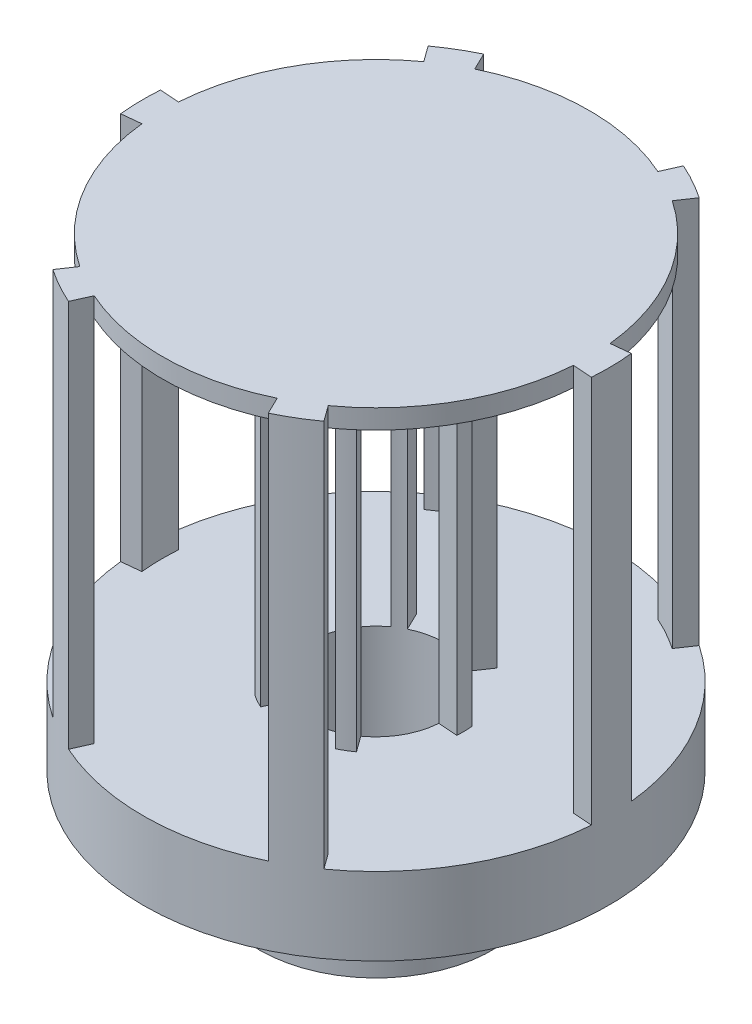
from build123d import *

# Parameters (mm, degrees)
SKETCH1_R           = 6
BOSS_EXTRUDE1_DEPTH = 6
SKETCH2_R           = 12
BOSS_EXTRUDE2_DEPTH = 3
BOSS_EXTRUDE3_START = 1
SKETCH5_R           = 12
SKETCH5_R_2         = 11
BOSS_EXTRUDE3_DEPTH = 1
SKETCH6_R           = 12
SKETCH6_R_2         = 11
BOSS_EXTRUDE4_DEPTH = 20
CUT_EXTRUDE1_START  = -20
CUT_EXTRUDE1_DEPTH  = 20
CIRPATTERN1_COUNT   = 6
SKETCH8_R           = 3.5
CUT_EXTRUDE2_DEPTH  = 9
BOSS_EXTRUDE5_DEPTH = 20
CIRPATTERN2_COUNT   = 6
BOSS_EXTRUDE6_START = -1
SKETCH12_R          = 11
BOSS_EXTRUDE6_DEPTH = 1


with BuildPart() as part:
    # Sketch1 → Boss-Extrude1 (new body)
    with BuildSketch(Plane(origin=(0, 0, 0), x_dir=(1, 0, 0), z_dir=(0, 1, 0))):
        Circle(SKETCH1_R)
    extrude(amount=BOSS_EXTRUDE1_DEPTH)

    # Sketch2 → Boss-Extrude2 (add)
    with BuildSketch(Plane(origin=(0, 6, 0), x_dir=(1, 0, 0), z_dir=(0, 1, 0))):
        Circle(SKETCH2_R)
    extrude(amount=BOSS_EXTRUDE2_DEPTH)

    # Sketch5 → Boss-Extrude3 (add)
    with BuildSketch(Plane.XZ.offset(-6).offset(BOSS_EXTRUDE3_START)):
        Circle(SKETCH5_R)
        Circle(SKETCH5_R_2, mode=Mode.SUBTRACT)
    extrude(amount=-BOSS_EXTRUDE3_DEPTH)

    # Sketch6 → Boss-Extrude4 (add)
    with BuildSketch(Plane(origin=(0, 9, 0), x_dir=(1, 0, 0), z_dir=(0, 1, 0))):
        Circle(SKETCH6_R)
        Circle(SKETCH6_R_2, mode=Mode.SUBTRACT)
    extrude(amount=BOSS_EXTRUDE4_DEPTH)

    # Sketch7 → Cut-Extrude1 (cut)
    with BuildSketch(Plane(origin=(0, 29, 0), x_dir=(1, 0, 0), z_dir=(0, 1, 0)).offset(CUT_EXTRUDE1_START)):
        with BuildLine():
            Line((-5.240054276, 10.795454191), (-4.803383087, 9.895833008))
            ThreePointArc((-4.803383087, 9.895833008), (-0.171183751, 10.998667925), (4.493092753, 10.040523767))
            Line((4.493092753, 10.040523767), (4.901555731, 10.953298655))
            ThreePointArc((4.901555731, 10.953298655), (-0.18674591, 11.998546827), (-5.240054276, 10.795454191))
        make_face()
    cut_extrude1 = extrude(amount=CUT_EXTRUDE1_DEPTH, mode=Mode.SUBTRACT)

    # CirPattern1: Cut-Extrude1 ×6 about axis
    cirpattern1_axis = Axis((0, 0, 0), (0, 1, 0))
    for i in range(1, CIRPATTERN1_COUNT):
        add(cut_extrude1.rotate(cirpattern1_axis, i * 360 / CIRPATTERN1_COUNT), mode=Mode.SUBTRACT)

    # Sketch8 → Cut-Extrude2 (cut)
    with BuildSketch(Plane.XZ):
        Circle(SKETCH8_R)
    extrude(amount=-CUT_EXTRUDE2_DEPTH, mode=Mode.SUBTRACT)

    # Sketch9 → Boss-Extrude5 (add)
    with BuildSketch(Plane(origin=(0, 9, 0), x_dir=(1, 0, 0), z_dir=(0, 1, 0))):
        with BuildLine():
            Line((-2.638146384, 3.645570416), (-2.051891632, 2.835443657))
            ThreePointArc((-2.051891632, 2.835443657), (-1.796958367, 3.003488077), (-1.528349164, 3.148674139))
            Line((-1.528349164, 3.148674139), (-1.965020354, 4.048295321))
            ThreePointArc((-1.965020354, 4.048295321), (-2.310375043, 3.861627527), (-2.638146384, 3.645570416))
        make_face()
    boss_extrude5 = extrude(amount=BOSS_EXTRUDE5_DEPTH)

    # CirPattern2: Boss-Extrude5 ×6 about axis
    cirpattern2_axis = Axis((0, 9, 0), (0, -1, 0))
    for i in range(1, CIRPATTERN2_COUNT):
        add(boss_extrude5.rotate(cirpattern2_axis, i * 360 / CIRPATTERN2_COUNT))

    # Sketch12 → Boss-Extrude6 (add)
    with BuildSketch(Plane(origin=(0, 29, 0), x_dir=(1, 0, 0), z_dir=(0, 1, 0)).offset(BOSS_EXTRUDE6_START)):
        Circle(SKETCH12_R)
    extrude(amount=BOSS_EXTRUDE6_DEPTH)


solid = part.part
